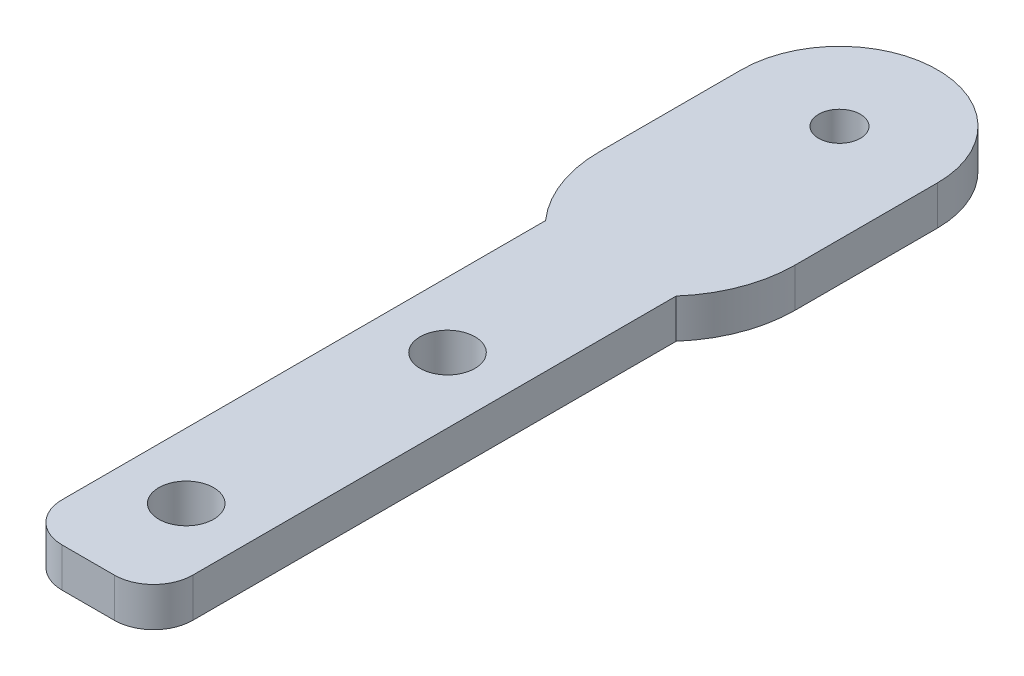
from build123d import *

# Parameters (mm, degrees)
EXTRUDE_1_DEPTH     = 3
SKETCH_2_R          = 1.6
CUT_EXTRUDE_1_DEPTH = 3
SKETCH_3_R          = 2.1
CUT_EXTRUDE_2_DEPTH = 3
CUT_EXTRUDE_3_DEPTH = 10
FILLET_1_R          = 10
FILLET_2_R          = 3


with BuildPart() as part:
    # 草图1 → 凸台-拉伸1 (new body)
    with BuildSketch(Plane(origin=(0, 0, 0), x_dir=(1, 0, 0), z_dir=(0, 1, 0))):
        with BuildLine():
            Line((-7.5, -30), (7.5, -30))
            Line((7.5, -30), (7.5, 30))
            ThreePointArc((7.5, 30), (0, 37.5), (-7.5, 30))
            Line((-7.5, 30), (-7.5, -30))
        make_face()
    extrude(amount=EXTRUDE_1_DEPTH)

    # 草图2 → 切除-拉伸1 (cut)
    with BuildSketch(Plane(origin=(0, 3, 0), x_dir=(1, 0, 0), z_dir=(0, 1, 0))):
        with Locations(Location((0, 30, 0), (0, 0, 270))):
            Circle(SKETCH_2_R)
    extrude(amount=-CUT_EXTRUDE_1_DEPTH, mode=Mode.SUBTRACT)

    # 草图3 → 切除-拉伸2 (cut)
    with BuildSketch(Plane.XZ):
        with Locations(Location((0, 20, 0), (0, 0, 270))):
            Circle(SKETCH_3_R)
        with Locations(Location((0, 0, 0), (0, 0, 270))):
            Circle(SKETCH_3_R)
    extrude(amount=-CUT_EXTRUDE_2_DEPTH, mode=Mode.SUBTRACT)

    # 草图4 → 切除-拉伸3 (cut)
    with BuildSketch(Plane.XZ):
        Polygon((-7.5, -12.5), (-4.9980923, -12.5), (-4.9980923, 27.5), (5.0019077, 27.5), (5.0019077, -12.5), (7.5, -12.5), (7.5, 30), (-7.5, 30), align=None)
    extrude(amount=-CUT_EXTRUDE_3_DEPTH, mode=Mode.SUBTRACT)

    # 圆角1
    # the kernel refuses this fillet: 10 mm, written as the material it takes off along each edge
    with BuildSketch(Plane(origin=(7.5, -16.5305363, -12.5), x_dir=(0, 0, -1), z_dir=(0, 1, 0))) as fillet_1_piece_1:
        with BuildLine():
            CenterArc((6.61221452, 10), FILLET_1_R, 228.606905679, 41.393094321)
            Line((0, 2.4980923), (-0.13224429, 2.348054146))
            ThreePointArc((-0.13224429, 2.348054146), (-0.2, 1.24904615), (-0.2, 0))
            Line((-0.2, 0), (0, -0.2))
            Line((0, -0.2), (6.61221452, -0.2))
            Line((6.61221452, -0.2), (6.61221452, 0))
        make_face()
    extrude(amount=36.061072601, mode=Mode.SUBTRACT)
    with BuildSketch(Plane(origin=(-7.5, -16.541351944, -12.5), x_dir=(0, 0, -1), z_dir=(0, 1, 0))) as fillet_1_piece_2:
        with BuildLine():
            CenterArc((6.616540778, -10), FILLET_1_R, 90, 41.426144493)
            Line((0, -2.5019077), (-0.132330816, -2.351945854))
            ThreePointArc((-0.132330816, -2.351945854), (-0.2, -1.25095385), (-0.2, 0))
            Line((-0.2, 0), (0, 0.2))
            Line((0, 0.2), (6.616540778, 0.2))
            Line((6.616540778, 0.2), (6.616540778, 0))
        make_face()
    extrude(amount=36.082703888, mode=Mode.SUBTRACT)

    # 圆角2
    fillet_2_edges = [part.edges().sort_by_distance(p)[0] for p in [
        (5.0019077, 1.5, 27.5),
        (-4.9980923, 1.5, 27.5),
    ]]
    fillet(fillet_2_edges, radius=FILLET_2_R)


solid = part.part
